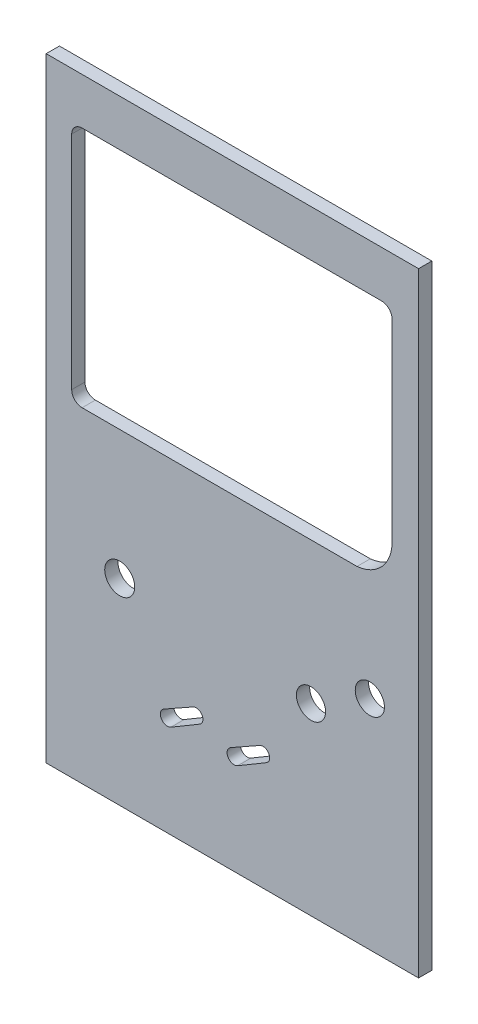
from build123d import *

# Parameters (mm, degrees)
SKETCH1_7_W   = 89.29
SKETCH1_7_H   = 147.294272307
SKETCH1_7_R   = 3.6
SKETCH1_7_R_2 = 3.5
BODY_DEPTH    = 3.18


with BuildPart() as part:
    # Sketch1<7> → Body (new body)
    with BuildSketch(Plane.XY):
        with Locations((0.105848892, -0.017058674)):
            Rectangle(SKETCH1_7_W, SKETCH1_7_H)
        with BuildLine():
            ThreePointArc((-14.641551271, -51.285483428), (-16.940439708, -50.641794665), (-16.296750946, -48.342906228))
            Line((-16.296750946, -48.342906228), (-9.324146649, -44.420816311))
            ThreePointArc((-9.324146649, -44.420816311), (-7.152105158, -45.022980632), (-7.741744524, -47.198455643))
            Line((-7.741744524, -47.198455643), (-14.641551271, -51.285483428))
        make_face(mode=Mode.SUBTRACT)
        with Locations((-26.900831216, -26.517202566)):
            Circle(SKETCH1_7_R, mode=Mode.SUBTRACT)
        with BuildLine():
            ThreePointArc((1.358448729, -51.285483428), (-0.940439708, -50.641794665), (-0.296750946, -48.342906228))
            Line((-0.296750946, -48.342906228), (6.675853351, -44.420816311))
            ThreePointArc((6.675853351, -44.420816311), (8.847894842, -45.022980632), (8.258255476, -47.198455643))
            Line((8.258255476, -47.198455643), (1.358448729, -51.285483428))
        make_face(mode=Mode.SUBTRACT)
        with Locations((18.957561099, -29.561304194)):
            Circle(SKETCH1_7_R_2, mode=Mode.SUBTRACT)
        with Locations((33.068305831, -21.491722051)):
            Circle(SKETCH1_7_R_2, mode=Mode.SUBTRACT)
        with BuildLine():
            Line((-35.919151108, 62.490077479), (35.889642662, 62.490077479))
            ThreePointArc((35.889642662, 62.490077479), (37.657409615, 61.757844432), (38.389642662, 59.990077479))
            Line((38.389642662, 59.990077479), (38.389642662, 13.668014642))
            ThreePointArc((38.389642662, 13.668014642), (35.990372343, 7.41277043), (29.997375098, 4.418014642))
            Line((29.997375098, 4.418014642), (-35.919151108, 4.418014642))
            ThreePointArc((-35.919151108, 4.418014642), (-37.686918061, 5.150247689), (-38.419151108, 6.918014642))
            Line((-38.419151108, 6.918014642), (-38.419151108, 59.990077479))
            ThreePointArc((-38.419151108, 59.990077479), (-37.686918061, 61.757844432), (-35.919151108, 62.490077479))
        make_face(mode=Mode.SUBTRACT)
    extrude(amount=BODY_DEPTH)


solid = part.part
